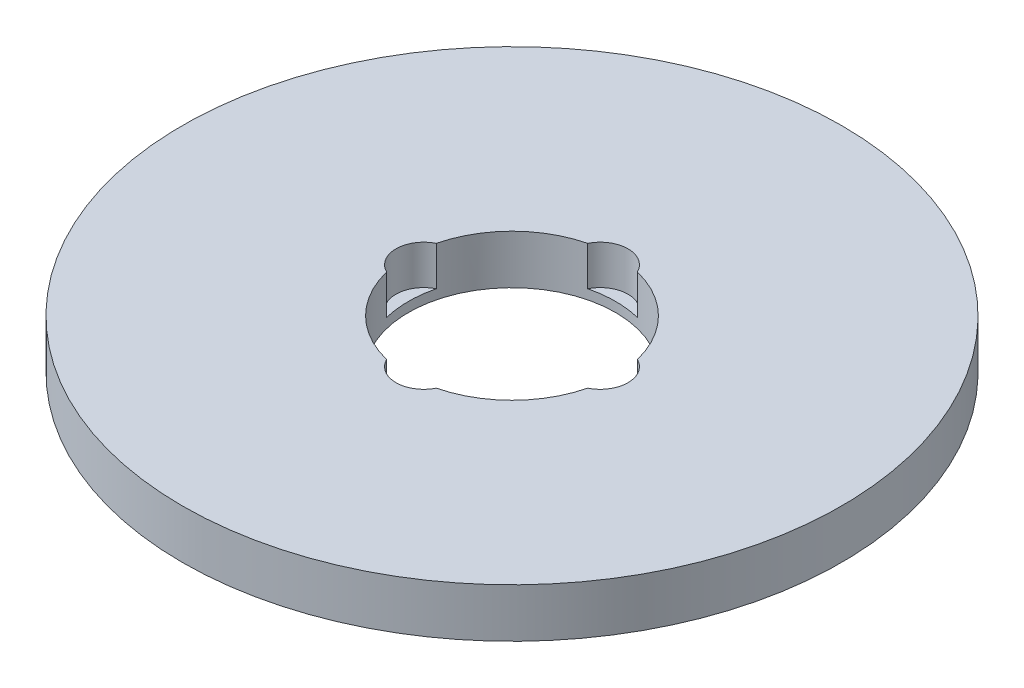
from build123d import *

# Parameters (mm, degrees)
SKETCH1_R           = 87.5
BOSS_EXTRUDE1_DEPTH = 13
SKETCH2_R           = 27.5
CUT_EXTRUDE1_DEPTH  = 125.424676009
SKETCH3_R           = 7.348472637
CUT_EXTRUDE2_DEPTH  = 10.445084197
CIRPATTERN1_COUNT   = 4


with BuildPart() as part:
    # Sketch1 → Boss-Extrude1 (new body)
    with BuildSketch(Plane(origin=(0, 0, 0), x_dir=(1, 0, 0), z_dir=(0, 1, 0))):
        Circle(SKETCH1_R)
    extrude(amount=BOSS_EXTRUDE1_DEPTH)

    # Sketch2 → Cut-Extrude1 (cut, through all)
    with BuildSketch(Plane(origin=(0, 0, 0), x_dir=(1, 0, 0), z_dir=(0, 1, 0))):
        Circle(SKETCH2_R)
    extrude(amount=CUT_EXTRUDE1_DEPTH, mode=Mode.SUBTRACT)

    # Sketch3 → Cut-Extrude2 (cut)
    with BuildSketch(Plane(origin=(0, 13, 0), x_dir=(1, 0, 0), z_dir=(0, 1, 0))):
        with Locations((-23.449361097, 0)):
            Circle(SKETCH3_R)
    cut_extrude2 = extrude(amount=-CUT_EXTRUDE2_DEPTH, mode=Mode.SUBTRACT)

    # CirPattern1: Cut-Extrude2 ×4 about axis
    cirpattern1_axis = Axis((0, 0, 0), (0, 1, 0))
    for i in range(1, CIRPATTERN1_COUNT):
        add(cut_extrude2.rotate(cirpattern1_axis, i * 360 / CIRPATTERN1_COUNT), mode=Mode.SUBTRACT)


solid = part.part
